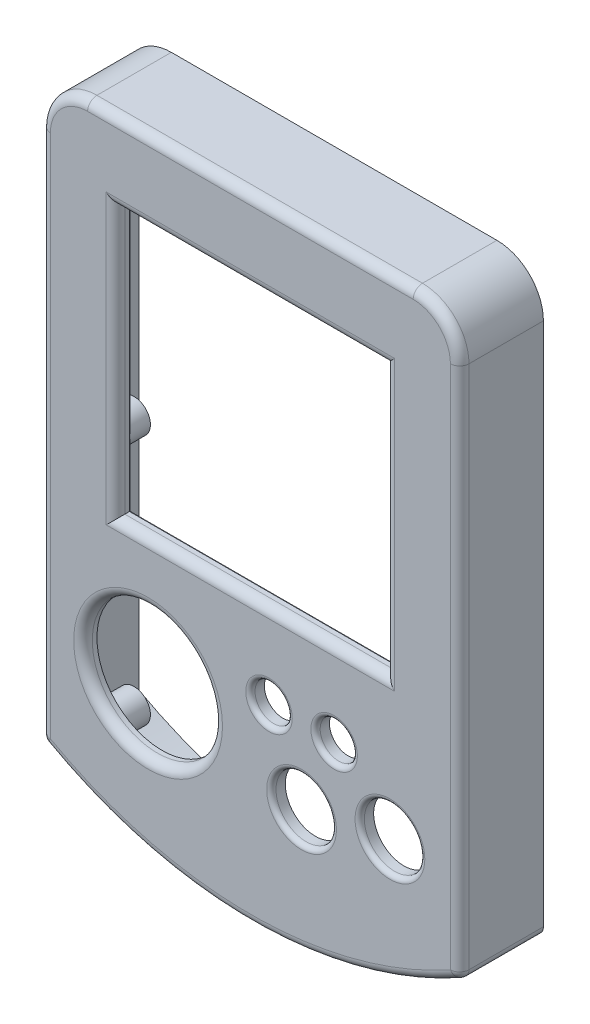
from build123d import *

# Parameters (mm, degrees)
EXTRUDE_1_DEPTH     = 9
CUT_EXTRUDE_2_DEPTH = 83.036577208
SHELL_2_T           = -1.5
SKETCH_4_R          = 7
SKETCH_4_R_2        = 3.25
SKETCH_4_R_3        = 2
SKETCH_4_W          = 29
SKETCH_4_H          = 29
CUT_EXTRUDE_3_DEPTH = 83.036577208
FILLET_1_R          = 1
FILLET_2_R          = 1
FILLET_3_R          = 0.5
FILLET_5_R          = 1
FILLET_7_R          = 1
SKETCH_5_W          = 33.7
SKETCH_5_H          = 37.6
SKETCH_5_W_2        = 31.7
SKETCH_5_H_2        = 35.6
EXTRUDE_2_DEPTH     = 1.4
SKETCH_6_R          = 1.75
SKETCH_6_R_2        = 0.75
EXTRUDE_3_DEPTH     = 3.7


with BuildPart() as part:
    # 草图1 → 凸台-拉伸1 (new body)
    with BuildSketch(Plane.XY):
        with BuildLine():
            Line((-40, 68), (-5, 68))
            ThreePointArc((-5, 68), (-1.464466094, 66.535533906), (0, 63))
            Line((0, 63), (0, 0))
            Line((0, 0), (-45, 0))
            Line((-45, 0), (-45, 63))
            ThreePointArc((-45, 63), (-43.535533906, 66.535533906), (-40, 68))
        make_face()
    extrude(amount=EXTRUDE_1_DEPTH)

    # 草图3 → 切除-拉伸2 (cut, through all)
    with BuildSketch(Plane(origin=(0, 0, 0), x_dir=(-1, 0, 0), z_dir=(0, 0, -1))):
        with BuildLine():
            Line((0, 0), (22.5, 0))
            ThreePointArc((22.5, 0), (10.856868978, 1.525758667), (0, 6))
            Line((0, 6), (0, 0))
        make_face()
        with BuildLine():
            Line((45, 0), (45, 6))
            ThreePointArc((45, 6), (34.143131022, 1.525758667), (22.5, 0))
            Line((22.5, 0), (45, 0))
        make_face()
    extrude(amount=-CUT_EXTRUDE_2_DEPTH, mode=Mode.SUBTRACT)

    # 抽壳2
    shell_2_openings = [part.faces().sort_by_distance(p)[0] for p in [
        (-22.5, 34.832437255, 0),
    ]]
    offset(amount=SHELL_2_T, openings=shell_2_openings, kind=Kind.INTERSECTION)

    # 草图4 → 切除-拉伸3 (cut, through all)
    with BuildSketch(Plane(origin=(0, 0, 0), x_dir=(-1, 0, 0), z_dir=(0, 0, -1))):
        with Locations((33.5, 17)):
            Circle(SKETCH_4_R)
        with Locations((7.5, 15.5)):
            Circle(SKETCH_4_R_2)
        with Locations((17, 13.5)):
            Circle(SKETCH_4_R_2)
        with Locations((13.5, 21.5)):
            Circle(SKETCH_4_R_3)
        with Locations((20.5, 21.5)):
            Circle(SKETCH_4_R_3)
        with Locations((22.5, 45)):
            Rectangle(SKETCH_4_W, SKETCH_4_H)
    extrude(amount=-CUT_EXTRUDE_3_DEPTH, mode=Mode.SUBTRACT)

    # 圆角1
    fillet_1_edges = [part.edges().sort_by_distance(p)[0] for p in [
        (-22.5, 59.5, 9),
        (-8, 45, 9),
        (-22.5, 30.5, 9),
        (-37, 45, 9),
    ]]
    fillet(fillet_1_edges, radius=FILLET_1_R)

    # 圆角2
    fillet_2_edges = [part.edges().sort_by_distance(p)[0] for p in [
        (-26.5, 17, 9),
    ]]
    fillet(fillet_2_edges, radius=FILLET_2_R)

    # 圆角3
    fillet_3_edges = [part.edges().sort_by_distance(p)[0] for p in [
        (-11.5, 21.5, 9),
        (-18.5, 21.5, 9),
        (-4.25, 15.5, 9),
        (-13.75, 13.5, 9),
    ]]
    fillet(fillet_3_edges, radius=FILLET_3_R)

    # 圆角5
    fillet_5_edges = [part.edges().sort_by_distance(p)[0] for p in [
        (0, 6, 4.5),
        (-45, 6, 4.5),
    ]]
    fillet(fillet_5_edges, radius=FILLET_5_R)

    # 圆角7
    fillet_7_edges = [part.edges().sort_by_distance(p)[0] for p in [
        (-0.137862267, 6.076614374, 9),
        (-44.862137733, 6.076614374, 9),
        (-22.5, 0, 9),
        (-45, 34.791644181, 9),
        (-43.535533906, 66.535533906, 9),
        (0, 34.791644181, 9),
        (-1.464466094, 66.535533906, 9),
        (-22.5, 68, 9),
    ]]
    fillet(fillet_7_edges, radius=FILLET_7_R)

    # 草图5 → 凸台-拉伸2 (add)
    with BuildSketch(Plane(origin=(0, 0, 7.5), x_dir=(-1, 0, 0), z_dir=(0, 0, -1))):
        with Locations((22.5, 46.95)):
            Rectangle(SKETCH_5_W, SKETCH_5_H)
        with Locations((22.5, 46.95)):
            Rectangle(SKETCH_5_W_2, SKETCH_5_H_2, mode=Mode.SUBTRACT)
    extrude(amount=EXTRUDE_2_DEPTH)

    # 草图6 → 凸台-拉伸3 (add)
    # profile 1 of 6: a face of its own
    with BuildSketch(Plane(origin=(0, 0, 7.5), x_dir=(-1, 0, 0), z_dir=(0, 0, -1))):
        with Locations((4.8, 63)):
            Circle(SKETCH_6_R)
        with Locations((4.8, 63)):
            Circle(SKETCH_6_R_2, mode=Mode.SUBTRACT)
    # profile 2 of 6: a face of its own
    with BuildSketch(Plane(origin=(0, 0, 7.5), x_dir=(-1, 0, 0), z_dir=(0, 0, -1))):
        with Locations((4.8, 36)):
            Circle(SKETCH_6_R)
        with Locations((4.8, 36)):
            Circle(SKETCH_6_R_2, mode=Mode.SUBTRACT)
    # profile 3 of 6: a face of its own
    with BuildSketch(Plane(origin=(0, 0, 7.5), x_dir=(-1, 0, 0), z_dir=(0, 0, -1))):
        with Locations((4.8, 9)):
            Circle(SKETCH_6_R)
        with Locations((4.8, 9)):
            Circle(SKETCH_6_R_2, mode=Mode.SUBTRACT)
    # profile 4 of 6: a face of its own
    with BuildSketch(Plane(origin=(0, 0, 7.5), x_dir=(-1, 0, 0), z_dir=(0, 0, -1))):
        with Locations((40.2, 9)):
            Circle(SKETCH_6_R)
        with Locations((40.2, 9)):
            Circle(SKETCH_6_R_2, mode=Mode.SUBTRACT)
    # profile 5 of 6: a face of its own
    with BuildSketch(Plane(origin=(0, 0, 7.5), x_dir=(-1, 0, 0), z_dir=(0, 0, -1))):
        with Locations((40.2, 36)):
            Circle(SKETCH_6_R)
        with Locations((40.2, 36)):
            Circle(SKETCH_6_R_2, mode=Mode.SUBTRACT)
    # profile 6 of 6: a face of its own
    with BuildSketch(Plane(origin=(0, 0, 7.5), x_dir=(-1, 0, 0), z_dir=(0, 0, -1))):
        with Locations((40.2, 63)):
            Circle(SKETCH_6_R)
        with Locations((40.2, 63)):
            Circle(SKETCH_6_R_2, mode=Mode.SUBTRACT)
    extrude(amount=EXTRUDE_3_DEPTH)


solid = part.part
